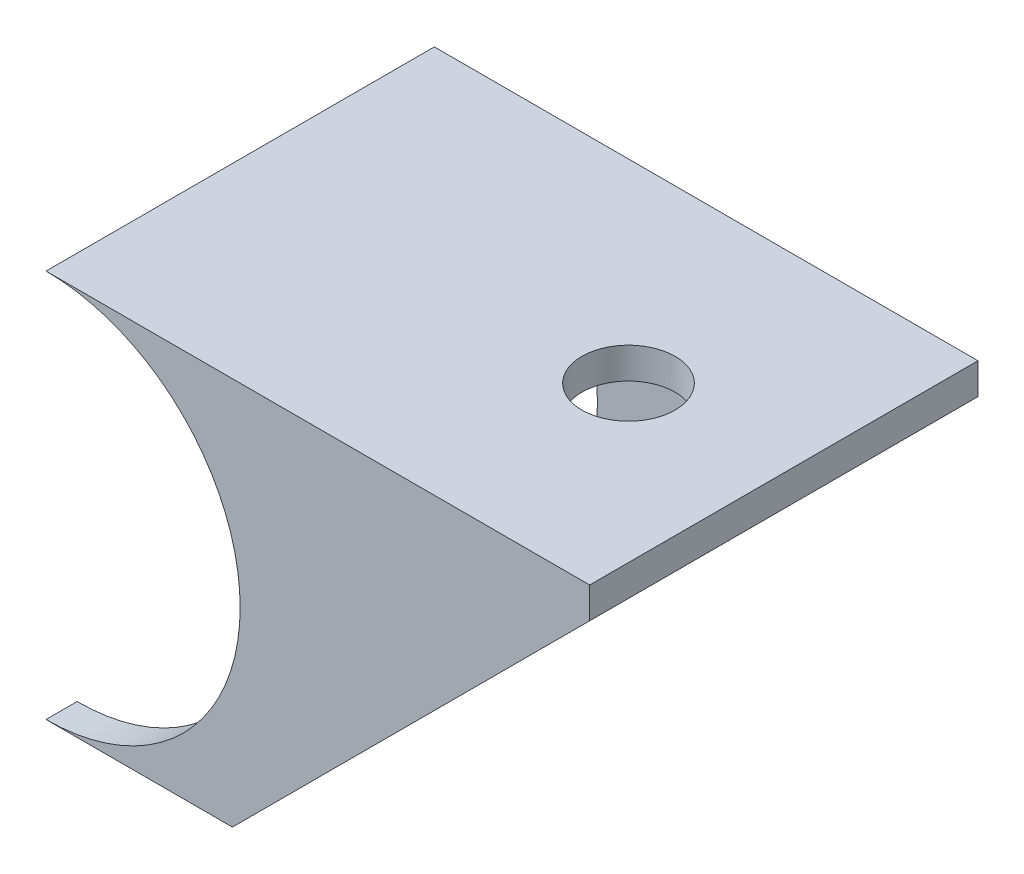
from build123d import *

# Parameters (mm, degrees)
DODANIE_WYCI_GNI_CIE1_DEPTH = 12.5
SKORUPA2_START              = -10.714285714
SKORUPA2_OUTLINE_W          = 37
SKORUPA2_OUTLINE_H          = 21
SKORUPA2_DEPTH              = 23
SZKIC2_R                    = 3
SZKIC2_R_2                  = 4
WYTNIJ_WYCI_GNI_CIE1_DEPTH  = 60


# Read off the part's stored shape, not the designer's step: Skorupa2
with BuildPart() as part:
    # Szkic1 → Dodanie-wyciągnięcie1 (new, symmetric)
    with BuildSketch(Plane.XY):
        with BuildLine():
            Line((20, 12.285714286), (-3, -10.714285714))
            Line((-3, -10.714285714), (-15, -10.714285714))
            ThreePointArc((-15, -10.714285714), (-2.5, 1.785714286), (-15, 14.285714286))
            Line((-15, 14.285714286), (20, 14.285714286))
            Line((20, 14.285714286), (20, 12.285714286))
        make_face()
    extrude(amount=DODANIE_WYCI_GNI_CIE1_DEPTH, both=True)

    # Skorupa2 outline → Skorupa2 (cut)
    with BuildSketch(Plane(origin=(0, 0, 0), x_dir=(1, 0, 0), z_dir=(0, 1, 0)).offset(SKORUPA2_START)):
        with Locations((2.5, 0)):
            Rectangle(SKORUPA2_OUTLINE_W, SKORUPA2_OUTLINE_H)
    extrude(amount=SKORUPA2_DEPTH, mode=Mode.SUBTRACT)

    # Szkic2 → Wytnij-wyciągnięcie1 (cut)
    with BuildSketch(Plane(origin=(0, 14.285714286, 0), x_dir=(1, 0, 0), z_dir=(0, 1, 0))):
        with Locations(Location((10, 0, 0), (0, 0, 180))):
            Circle(SZKIC2_R)
        with Locations((8, -24.919871589)):
            Circle(SZKIC2_R_2)
    extrude(amount=-WYTNIJ_WYCI_GNI_CIE1_DEPTH, mode=Mode.SUBTRACT)


solid = part.part
